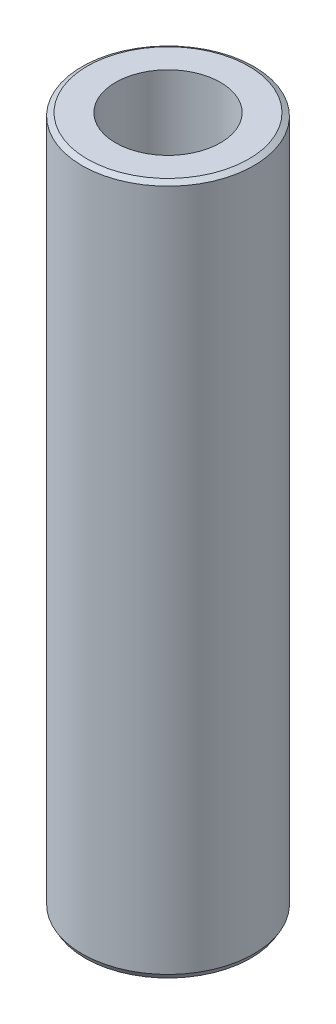
from build123d import *
from OCP.BRepFilletAPI import BRepFilletAPI_MakeChamfer

# Parameters (mm, degrees)
SKETCH1_R           = 22.5
BOSS_EXTRUDE1_DEPTH = 180.987040028
SKETCH2_R           = 13.737684556
CUT_EXTRUDE1_DEPTH  = 184.762914262
CHAMFER1_SIZE       = 0.796037219
CHAMFER1_SIZE2      = 1.378776908


with BuildPart() as part:
    # Sketch1 → Boss-Extrude1 (new body)
    with BuildSketch(Plane(origin=(0, 0, 0), x_dir=(1, 0, 0), z_dir=(0, 1, 0))):
        Circle(SKETCH1_R)
    extrude(amount=BOSS_EXTRUDE1_DEPTH)

    # Sketch2 → Cut-Extrude1 (cut, through all)
    with BuildSketch(Plane(origin=(0, 0, 0), x_dir=(1, 0, 0), z_dir=(0, 1, 0))):
        Circle(SKETCH2_R)
    extrude(amount=CUT_EXTRUDE1_DEPTH, mode=Mode.SUBTRACT)

    # Chamfer1: one chamfer whose edges measure the first distance from different faces: ONE call of the kernel's chamfer builder (chamfer() names one face for all edges)
    chamfer1_edges_1 = [part.edges().sort_by_distance(p)[0] for p in [
        (-22.5, 180.987040028, 0),
    ]]
    chamfer1_side_1 = [part.faces().sort_by_distance(p)[0] for p in [
        (-22.5, 90.493520014, 0),
    ]]
    chamfer1_edges_2 = [part.edges().sort_by_distance(p)[0] for p in [
        (-22.5, 0, 0),
    ]]
    chamfer1_side_2 = [part.faces().sort_by_distance(p)[0] for p in [
        (-21.863603897, 0, 0),
    ]]
    chamfer1 = BRepFilletAPI_MakeChamfer(part.part.solid().wrapped)
    for e in chamfer1_edges_1:
        chamfer1.Add(CHAMFER1_SIZE, CHAMFER1_SIZE2, e.wrapped, chamfer1_side_1[0].wrapped)  # the first distance lies on this face
    for e in chamfer1_edges_2:
        chamfer1.Add(CHAMFER1_SIZE, CHAMFER1_SIZE2, e.wrapped, chamfer1_side_2[0].wrapped)  # the first distance lies on this face
    add(Compound.cast(chamfer1.Shape()), mode=Mode.REPLACE)


solid = part.part
